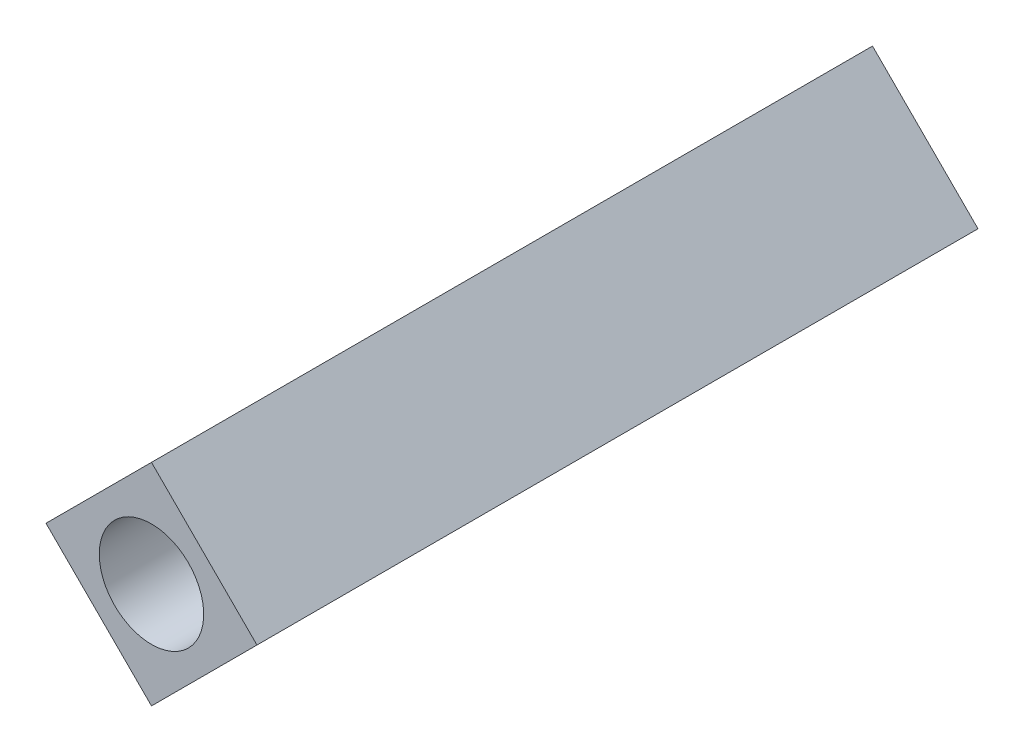
from build123d import *

# Parameters (mm, degrees)
SKETCH_1_R      = 2.1
EXTRUDE_1_DEPTH = 29


with BuildPart() as part:
    # ｽｹｯﾁ1 → ﾎﾞｽ - 押し出し1 (new body)
    with BuildSketch(Plane.XY):
        Polygon((4.242640687, 0), (0, 4.242640687), (-4.242640687, 0), (0, -4.242640687), align=None)
        Circle(SKETCH_1_R, mode=Mode.SUBTRACT)
    extrude(amount=EXTRUDE_1_DEPTH)


solid = part.part
